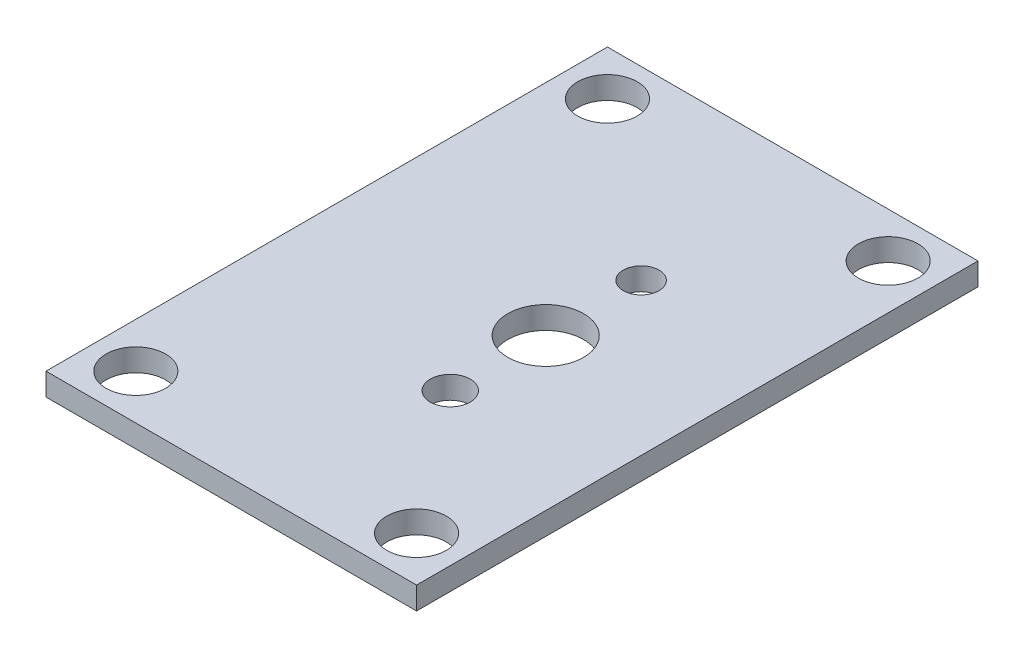
from build123d import *

# Parameters (mm, degrees)
SKETCH1_W           = 25
SKETCH1_H           = 50
SKETCH1_R           = 3.375
BOSS_EXTRUDE1_DEPTH = 2
SKETCH2_W           = 50
SKETCH2_H           = 2
BOSS_EXTRUDE2_DEPTH = 8
SKETCH3_W           = 8
SKETCH3_H           = 50
BOSS_EXTRUDE3_DEPTH = 42
SKETCH4_R           = 2.65
CUT_EXTRUDE1_DEPTH  = 3.3
SKETCH5_R           = 5.802370205
CUT_EXTRUDE2_DEPTH  = 9
FILLET2_R           = 1
SKETCH6_R           = 12.7
BOSS_EXTRUDE4_DEPTH = 2
FILLET4_R           = 1
SKETCH8_R           = 1.589780168
SKETCH8_R_2         = 1.777428262
CUT_EXTRUDE3_DEPTH  = 10
SKETCH9_W           = 8
SKETCH9_H           = 42
CUT_EXTRUDE4_DEPTH  = 68.79439129
SKETCH10_W          = 33.517939775
SKETCH10_H          = 7.212330843
CUT_EXTRUDE5_DEPTH  = 55


with BuildPart() as part:
    # Sketch1 → Boss-Extrude1 (new body)
    with BuildSketch(Plane(origin=(0, 0, 0), x_dir=(1, 0, 0), z_dir=(0, 1, 0))):
        with Locations((2.276951673, 11.384758364)):
            Rectangle(SKETCH1_W, SKETCH1_H)
        with Locations(Location((1.276951673, 11.384758364, 0), (0, 0, 270))):
            Circle(SKETCH1_R, mode=Mode.SUBTRACT)
    extrude(amount=BOSS_EXTRUDE1_DEPTH)

    # Sketch2 → Boss-Extrude2 (add)
    with BuildSketch(Plane.ZY.offset(10.223048327)):
        with Locations((-11.384758364, 1)):
            Rectangle(SKETCH2_W, SKETCH2_H)
    extrude(amount=BOSS_EXTRUDE2_DEPTH)

    # Sketch3 → Boss-Extrude3 (add)
    with BuildSketch(Plane.XZ):
        with Locations((-14.223048327, -11.384758364)):
            Rectangle(SKETCH3_W, SKETCH3_H)
    extrude(amount=BOSS_EXTRUDE3_DEPTH)

    # Sketch4 → Cut-Extrude1 (cut)
    with BuildSketch(Plane(origin=(0, 2, 0), x_dir=(1, 0, 0), z_dir=(0, 1, 0))):
        with Locations(Location((-14.223048327, 32.384758364, 0), (0, 0, 270))):
            Circle(SKETCH4_R)
        with Locations(Location((-14.223048327, -9.615241636, 0), (0, 0, 270))):
            Circle(SKETCH4_R)
    cut_extrude1 = extrude(amount=-CUT_EXTRUDE1_DEPTH, mode=Mode.SUBTRACT)

    # Mirror1: Cut-Extrude1 across plane
    add(cut_extrude1.mirror(Plane.ZX.offset(-20)), mode=Mode.SUBTRACT)

    # Sketch5 → Cut-Extrude2 (cut)
    with BuildSketch(Plane.ZY.offset(18.223048327)):
        with Locations((-11.836279124, -21)):
            Circle(SKETCH5_R)
    extrude(amount=-CUT_EXTRUDE2_DEPTH, mode=Mode.SUBTRACT)

    # Fillet2
    fillet2_edges = [part.edges().sort_by_distance(p)[0] for p in [
        (-10.223048327, -21, -17.638649329),
    ]]
    fillet(fillet2_edges, radius=FILLET2_R)

    # Mirror2: Cut-Extrude1 across plane
    add(cut_extrude1.mirror(Plane.ZY.offset(1.723048327)), mode=Mode.SUBTRACT)

    # Sketch6 → Boss-Extrude4 (add)
    with BuildSketch(Plane(origin=(0, 2, 0), x_dir=(1, 0, 0), z_dir=(0, 1, 0))):
        with BuildLine():
            Line((14.776951673, 5.567542535), (14.776951673, 17.201974193))
            ThreePointArc((14.776951673, 17.201974193), (-13.423048327, 11.384758364), (14.776951673, 5.567542535))
        make_face()
        with Locations(Location((1.276951673, 11.384758364, 0), (0, 0, 270))):
            Circle(SKETCH6_R, mode=Mode.SUBTRACT)
    extrude(amount=BOSS_EXTRUDE4_DEPTH)

    # Fillet4
    # the kernel refuses this fillet: 1 mm, written as the material it takes off along each edge
    with BuildSketch(Plane(origin=(14.776951673, 4, -3.067542535), x_dir=(0, -1, 0), z_dir=(0, 0, -1))) as fillet4_piece_1:
        with BuildLine():
            CenterArc((FILLET4_R, FILLET4_R), FILLET4_R, 180, 90)
            Line((0, FILLET4_R), (0, 0))
            Line((0, 0), (FILLET4_R, 0))
        make_face()
    extrude(amount=16.634431658, mode=Mode.SUBTRACT)

    # Sketch8 → Cut-Extrude3 (cut)
    with BuildSketch(Plane(origin=(0, 2, 0), x_dir=(1, 0, 0), z_dir=(0, 1, 0))):
        with Locations(Location((1.276951673, 19.884758364, 0), (0, 0, 270))):
            Circle(SKETCH8_R)
        with Locations(Location((1.276951673, 2.884758364, 0), (0, 0, 270))):
            Circle(SKETCH8_R_2)
    extrude(amount=-CUT_EXTRUDE3_DEPTH, mode=Mode.SUBTRACT)

    # Sketch9 → Cut-Extrude4 (cut, through all)
    with BuildSketch(Plane.XY.offset(13.615241636)):
        with Locations((-14.223048327, -21)):
            Rectangle(SKETCH9_W, SKETCH9_H)
    extrude(amount=-CUT_EXTRUDE4_DEPTH, mode=Mode.SUBTRACT)

    # Sketch10 → Cut-Extrude5 (cut)
    with BuildSketch(Plane.XY.offset(13.615241636)):
        with Locations((-1.464078439, 5.606165422)):
            Rectangle(SKETCH10_W, SKETCH10_H)
    extrude(amount=-CUT_EXTRUDE5_DEPTH, mode=Mode.SUBTRACT)


solid = part.part
